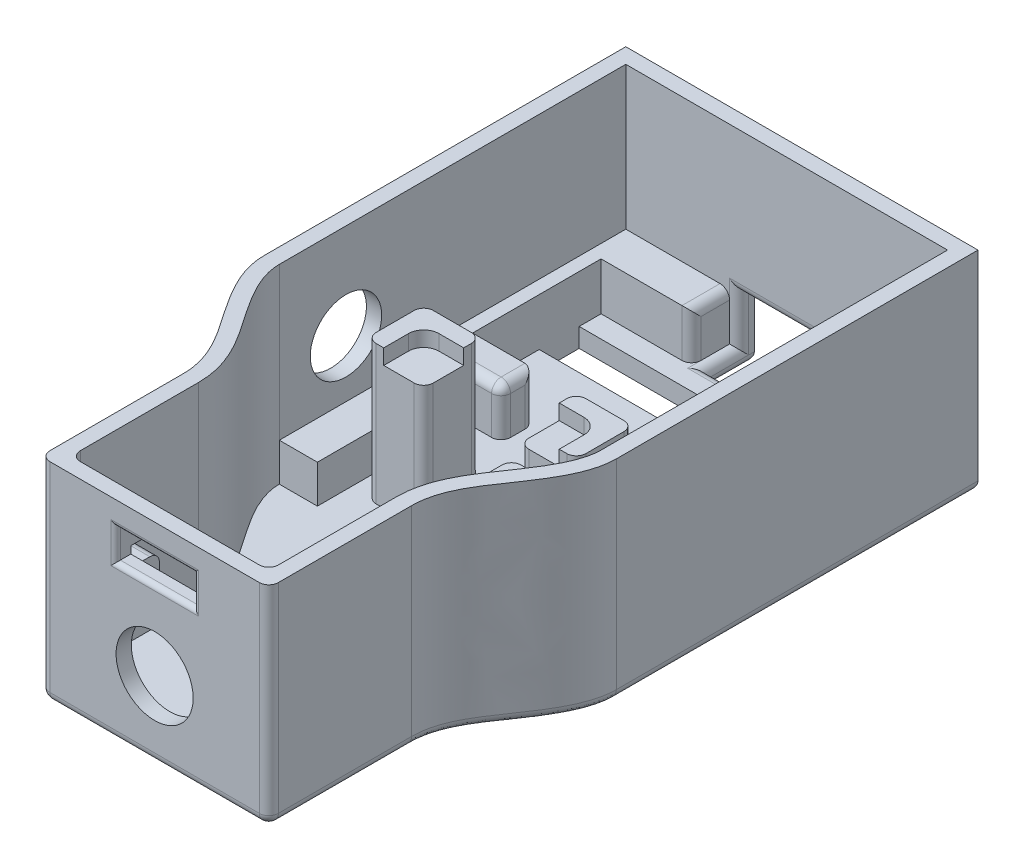
from build123d import *

# Parameters (mm, degrees)
BOSS_EXTRUDE1_DEPTH            = 2
BOSS_EXTRUDE2_DEPTH            = 20
FILLET1_R                      = 1
FILLET1_OF_MIRROR1_R           = 1
CUT_EXTRUDE1_REACH             = 75.255
SKETCH2_R                      = 4.05
SKETCH2_W                      = 8.2
SKETCH2_H                      = 3.2
BOSS_EXTRUDE3_DEPTH            = 5
SKETCH4_W                      = 10
SKETCH4_H                      = 7
CUT_EXTRUDE2_DEPTH             = 5
CUT_EXTRUDE3_REACH             = 81.956
SKETCH5_R                      = 3.75
SKETCH6_W                      = 4
SKETCH6_H                      = 15.4
BOSS_EXTRUDE4_DEPTH            = 4
BOSS_EXTRUDE5_DEPTH            = 3
SKETCH9_W                      = 6
SKETCH9_H                      = 6
BOSS_EXTRUDE7_DEPTH            = 13
BOSS_EXTRUDE8_DEPTH            = 1.6
SKETCH11_W                     = 10
SKETCH11_H                     = 5
BOSS_EXTRUDE9_DEPTH            = 1.95
FILLET2_R                      = 1
CUT_EXTRUDE4_REACH             = 74.746
SKETCH12_R                     = 1.7
CHAMFER1_SIZE                  = 1.8
FILLET3_R                      = 0.5
FILLET4_R                      = 0.5
FILLET5_R                      = 1
CUT_EXTRUDE5_REACH             = 75.255
SKETCH13_W                     = 4.2
SKETCH13_H                     = 2
CUT_EXTRUDE5_DIRECTION_2_REACH = 75.255
FILLET6_R                      = 1


# Some blends are built 0.0001 mm under size
with BuildPart() as part:
    # Sketch1 → Boss-Extrude1 (new body)
    with BuildSketch(Plane(origin=(0, 0, 0), x_dir=(1, 0, 0), z_dir=(0, 1, 0))):
        with BuildLine():
            Line((-18.5, 68), (0, 68))
            Line((0, 68), (0, 0))
            Line((0, 0), (-12, 0))
            Line((-12, 0), (-12, 15))
            add(Edge.make_bspline(
                [(-18.5, 30), (-18.5, 27.39470469), (-15.25, 22.360202971), (-12, 17.884889368), (-12, 15)],
                knots=[0, 0, 0, 0, 0.5, 1, 1, 1, 1], degree=3))
            Line((-18.5, 30), (-18.5, 68))
        make_face()
    boss_extrude1 = extrude(amount=-BOSS_EXTRUDE1_DEPTH)

    # Sketch1<3> → Boss-Extrude2 (add)
    with BuildSketch(Plane(origin=(0, 0, 0), x_dir=(1, 0, 0), z_dir=(0, 1, 0))):
        with BuildLine():
            Line((0, 68), (-18.5, 68))
            Line((-18.5, 68), (-18.5, 30))
            add(Edge.make_bspline(
                [(-18.5, 30), (-18.5, 27.39470469), (-15.25, 22.360202971), (-12, 17.884889368), (-12, 15)],
                knots=[0, 0, 0, 0, 0.5, 1, 1, 1, 1], degree=3))
            Line((-12, 15), (-12, 0))
            Line((-12, 0), (0, 0))
            Line((0, 0), (0, 1.6))
            Line((0, 1.6), (-10.4, 1.6))
            Line((-10.4, 1.6), (-10.4, 15))
            add(Edge.make_bspline(
                [(-10.4, 15), (-10.4, 15.425578207), (-10.461590664, 16.290428205), (-10.798327914, 17.886130877), (-11.539951261, 19.69830956), (-12.699618033, 21.622399051), (-13.939183968, 23.408598367), (-15.118088909, 25.160360175), (-16.101642577, 26.878994856), (-16.641544438, 28.239751095), (-16.862288026, 29.267999136), (-16.9, 29.752858105), (-16.9, 30)],
                knots=[0, 0, 0, 0, 0.0625, 0.125, 0.25, 0.375, 0.5, 0.625, 0.75, 0.875, 0.9375, 1, 1, 1, 1], degree=3))
            Line((-16.9, 30), (-16.9, 66.4))
            Line((-16.9, 66.4), (0, 66.4))
            Line((0, 66.4), (0, 68))
        make_face()
    boss_extrude2 = extrude(amount=BOSS_EXTRUDE2_DEPTH)

    # Fillet1
    fillet1_edges = [part.edges().sort_by_distance(p)[0] for p in [
        (-12, 9, 0),
        (-10.4, 10, -1.6),
    ]]
    fillet(fillet1_edges, radius=FILLET1_R)

    # Mirror1: Boss-Extrude1, Boss-Extrude2 across plane
    add(boss_extrude1.mirror(Plane(origin=(0, 0, 0), x_dir=(0, 0, 1), z_dir=(1, 0, 0))))
    add(boss_extrude2.mirror(Plane(origin=(0, 0, 0), x_dir=(0, 0, 1), z_dir=(1, 0, 0))))

    # Fillet1 of Mirror1
    fillet1_of_mirror1_edges = [part.edges().sort_by_distance(p)[0] for p in [
        (12, 9, 0),
        (10.4, 10, -1.6),
    ]]
    fillet(fillet1_of_mirror1_edges, radius=FILLET1_OF_MIRROR1_R)

    # Sketch2 → Cut-Extrude1 (cut, up to next)
    with BuildSketch(Plane.XY, mode=Mode.PRIVATE) as cut_extrude1_sk1:
        with Locations((0, 6)):
            Circle(SKETCH2_R)
    cut_extrude1_tool1 = extrude(cut_extrude1_sk1.sketch, amount=-CUT_EXTRUDE1_REACH, mode=Mode.PRIVATE) & part.part
    # Sketch2 → Cut-Extrude1 (cut, up to next)
    with BuildSketch(Plane.XY, mode=Mode.PRIVATE) as cut_extrude1_sk2:
        with Locations((0, 15.84)):
            Rectangle(SKETCH2_W, SKETCH2_H)
    cut_extrude1_tool2 = extrude(cut_extrude1_sk2.sketch, amount=-CUT_EXTRUDE1_REACH, mode=Mode.PRIVATE) & part.part
    add(cut_extrude1_tool1.solids().sort_by_distance((0, 6, 0))[0], mode=Mode.SUBTRACT)
    add(cut_extrude1_tool2.solids().sort_by_distance((0, 15.84, 0))[0], mode=Mode.SUBTRACT)

    # Sketch3 → Boss-Extrude3 (add)
    with BuildSketch(Plane(origin=(0, 0, 0), x_dir=(1, 0, 0), z_dir=(0, 1, 0))):
        Polygon((-16.9, 66.4), (-6, 66.4), (-6, 62.4), (-15.5, 62.4), (-15.5, 48.9), (-9, 48.9), (-9, 45.4), (-16.9, 45.4), align=None)
        Polygon((16.9, 66.4), (16.9, 45.4), (9, 45.4), (9, 48.9), (15.5, 48.9), (15.5, 62.4), (6, 62.4), (6, 66.4), align=None)
    extrude(amount=BOSS_EXTRUDE3_DEPTH)

    # Sketch4 → Cut-Extrude2 (cut)
    with BuildSketch(Plane(origin=(0, 0, -68), x_dir=(-1, 0, 0), z_dir=(0, 0, -1))):
        with Locations((0, 1.5)):
            Rectangle(SKETCH4_W, SKETCH4_H)
    extrude(amount=-CUT_EXTRUDE2_DEPTH, mode=Mode.SUBTRACT)

    # Sketch5 → Cut-Extrude3 (cut, up to next)
    with BuildSketch(Plane.ZY.offset(18.5), mode=Mode.PRIVATE) as cut_extrude3_sk1:
        with Locations((-37, 10)):
            Circle(SKETCH5_R)
    cut_extrude3_tool1 = extrude(cut_extrude3_sk1.sketch, amount=-CUT_EXTRUDE3_REACH, mode=Mode.PRIVATE) & part.part
    add(cut_extrude3_tool1.solids().sort_by_distance((-18.5, 10, -37))[0], mode=Mode.SUBTRACT)

    # Sketch6 → Boss-Extrude4 (add)
    with BuildSketch(Plane(origin=(0, 0, 0), x_dir=(1, 0, 0), z_dir=(0, 1, 0))):
        with Locations((-14.9, 37.7)):
            Rectangle(SKETCH6_W, SKETCH6_H)
    extrude(amount=BOSS_EXTRUDE4_DEPTH)

    # Sketch7 → Boss-Extrude5 (add)
    with BuildSketch(Plane(origin=(0, 0, -1.6), x_dir=(-1, 0, 0), z_dir=(0, 0, -1))):
        Polygon((4.1, 13), (9, 13), (9, 15), (4.1, 15), (4.1, 17), (11.1, 17), (11.1, 11), (4.1, 11), align=None)
    boss_extrude5 = extrude(amount=BOSS_EXTRUDE5_DEPTH)

    # Sketch9 → Boss-Extrude7 (add)
    with BuildSketch(Plane(origin=(0, 0, 0), x_dir=(1, 0, 0), z_dir=(0, 1, 0))):
        with Locations((-8.018025612, 36.288025612)):
            Rectangle(SKETCH9_W, SKETCH9_H)
    boss_extrude7 = extrude(amount=BOSS_EXTRUDE7_DEPTH)

    # Sketch10 → Boss-Extrude8 (add)
    with BuildSketch(Plane(origin=(0, 13, 0), x_dir=(1, 0, 0), z_dir=(0, 1, 0))):
        with BuildLine():
            Line((-11.018025612, 39.288025612), (-11.018025612, 33.288025612))
            Line((-11.018025612, 33.288025612), (-9.218025612, 33.288025612))
            Line((-9.218025612, 33.288025612), (-9.218025612, 35.888025612))
            ThreePointArc((-9.218025612, 35.888025612), (-8.749396462, 37.019396462), (-7.618025612, 37.488025612))
            Line((-7.618025612, 37.488025612), (-5.018025612, 37.488025612))
            Line((-5.018025612, 37.488025612), (-5.018025612, 39.288025612))
            Line((-5.018025612, 39.288025612), (-11.018025612, 39.288025612))
        make_face()
    boss_extrude8 = extrude(amount=BOSS_EXTRUDE8_DEPTH)

    # Mirror2: Boss-Extrude5, Boss-Extrude7, Boss-Extrude8 across plane
    add(boss_extrude5.mirror(Plane(origin=(0, 0, 0), x_dir=(0, 0, 1), z_dir=(1, 0, 0))))
    add(boss_extrude7.mirror(Plane(origin=(0, 0, 0), x_dir=(0, 0, 1), z_dir=(1, 0, 0))))
    add(boss_extrude8.mirror(Plane(origin=(0, 0, 0), x_dir=(0, 0, 1), z_dir=(1, 0, 0))))

    # Sketch11 → Boss-Extrude9 (add)
    with BuildSketch(Plane(origin=(0, 0, 0), x_dir=(1, 0, 0), z_dir=(0, 1, 0))):
        with Locations((0, 39.988025612)):
            Rectangle(SKETCH11_W, SKETCH11_H)
    extrude(amount=BOSS_EXTRUDE9_DEPTH)

    # Fillet2
    fillet2_edges = [part.edges().sort_by_distance(p)[0] for p in [
        (-6, 2.5, -62.4),
        (-9, 2.5, -48.9),
        (-11.018025612, 7.3, -33.288025612),
        (-11.018025612, 7.3, -39.288025612),
        (-5, 0.975, -42.488025612),
        (-9, 2.5, -45.4),
        (0, 5, -66.4),
        (5, 2.5, -66.4),
        (-5, 2.5, -66.4),
        (-5, 0, -64.7),
        (5, 0, -64.7),
        (0, 0, -63),
        (6, 2.5, -62.4),
        (9, 2.5, -45.4),
        (9, 2.5, -48.9),
        (11.018025612, 7.3, -33.288025612),
        (11.018025612, 7.3, -39.288025612),
        (5, 0.975, -42.488025612),
        (5.018025612, 6.5, -33.288025612),
        (-5.018025612, 6.5, -33.288025612),
        (5.018025612, 7.3, -39.288025612),
        (-5.018025612, 7.3, -39.288025612),
        (6, 5, -64.4),
        (-6, 5, -64.4),
        (-9, 5, -47.15),
        (9, 5, -47.15),
        (-12.95, 5, -45.4),
        (12.95, 5, -45.4),
    ]]
    fillet(fillet2_edges, radius=FILLET2_R - 0.0001)  # a hair under: the kernel refuses the full size

    # Sketch12 → Cut-Extrude4 (cut, up to next)
    with BuildSketch(Plane(origin=(0, 1.95, 0), x_dir=(1, 0, 0), z_dir=(0, 1, 0)), mode=Mode.PRIVATE) as cut_extrude4_sk1:
        with Locations(Location((0, 39.988025612, 0), (0, 0, 270))):
            Circle(SKETCH12_R)
    cut_extrude4_tool1 = extrude(cut_extrude4_sk1.sketch, amount=-CUT_EXTRUDE4_REACH, mode=Mode.PRIVATE) & part.part
    add(cut_extrude4_tool1.solids().sort_by_distance((0, 1.95, -39.988026))[0], mode=Mode.SUBTRACT)

    # Chamfer1
    chamfer1_edges = [part.edges().sort_by_distance(p)[0] for p in [
        (0, -2, -41.688025612),
    ]]
    chamfer(chamfer1_edges, length=CHAMFER1_SIZE)

    # Fillet3
    fillet3_edges = [part.edges().sort_by_distance(p)[0] for p in [
        (0, -0.2, -41.688025612),
    ]]
    fillet(fillet3_edges, radius=FILLET3_R)

    # Chamfer2
    # the kernel refuses this chamfer: 1.95 mm, written as the material it adds along each edge
    with BuildSketch(Plane(origin=(-5, 0, -37.488025612), x_dir=(0, 0.9996219169112968, -0.027495876610587132), z_dir=(1, 0, 0))) as chamfer2_piece_1_section:
        with BuildLine():
            Line((2.005912731, 0), (-0.110266952, 2.002879697))
            Line((-0.110266952, 2.002879697), (-0.149252207, 2.001807358))
            ThreePointArc((-0.149252207, 2.001807358), (-0.066551993, 1.001125768), (-0.038985255, -0.001072339))
            Line((-0.038985255, -0.001072339), (0.001072339, -0.038985255))
            ThreePointArc((0.001072339, -0.038985255), (1.003270446, -0.011418517), (2.00698507, -0.038985255))
            Line((2.00698507, -0.038985255), (2.005912731, 0))
        make_face()
    chamfer2_piece_1 = extrude(amount=10, mode=Mode.PRIVATE)
    chamfer2_piece_1 = split(chamfer2_piece_1, bisect_by=Plane(origin=(0, 1.95, -36.843737511), z_dir=(0, -1, 0)), keep=Keep.TOP, mode=Mode.PRIVATE)
    add(chamfer2_piece_1)
    with BuildSketch(Plane(origin=(-5, 0, -41.488125612), x_dir=(0.027495876610586247, 0.9996219169112968, 0), z_dir=(0, 0, 1))) as chamfer2_piece_2_section:
        with BuildLine():
            Line((2.005912731, 0), (-0.110266952, 2.002879697))
            Line((-0.110266952, 2.002879697), (-0.149252207, 2.001807358))
            ThreePointArc((-0.149252207, 2.001807358), (-0.066551993, 1.001125768), (-0.038985255, -0.001072339))
            Line((-0.038985255, -0.001072339), (0.001072339, -0.038985255))
            ThreePointArc((0.001072339, -0.038985255), (1.003270446, -0.011418517), (2.00698507, -0.038985255))
            Line((2.00698507, -0.038985255), (2.005912731, 0))
        make_face()
    chamfer2_piece_2 = extrude(amount=4.0001, mode=Mode.PRIVATE)
    chamfer2_piece_2 = split(chamfer2_piece_2, bisect_by=Plane(origin=(-5.644288101, 1.95, -39.488075612), z_dir=(0, -1, 0)), keep=Keep.TOP, mode=Mode.PRIVATE)
    add(chamfer2_piece_2)
    with BuildSketch(Plane(origin=(-4.0001, 0, -41.488125612), x_dir=(0, 0, -1), z_dir=(1, 0, 0))) as chamfer2_piece_3_section:
        with BuildLine():
            Line((0.944745671, 2.005154329), (3.005054329, -0.055154329))
            Line((3.005054329, -0.055154329), (3.005054329, -0.094154329))
            ThreePointArc((3.005054329, -0.094154329), (2.002477164, -0.039), (0.9999, -0.039))
            Line((0.9999, -0.039), (0.9609, 0))
            ThreePointArc((0.9609, 0), (0.9609, 1.002577164), (0.905745671, 2.005154329))
            Line((0.905745671, 2.005154329), (0.944745671, 2.005154329))
        make_face()
    chamfer2_piece_3 = revolve(axis=Axis((-4.0001, 0, -41.488125612), (0, 1, 0)), revolution_arc=90, mode=Mode.PRIVATE)
    chamfer2_piece_3 = split(chamfer2_piece_3, bisect_by=Plane(origin=(-5.140152653, 1.95, -42.628178265), z_dir=(0, -1, 0)), keep=Keep.TOP, mode=Mode.PRIVATE)
    add(chamfer2_piece_3)
    with BuildSketch(Plane(origin=(5, 0, -37.488025612), x_dir=(-0.027495876610586247, 0.9996219169112968, 0), z_dir=(0, 0, -1))) as chamfer2_piece_4_section:
        with BuildLine():
            Line((2.005912731, 0), (-0.110266952, 2.002879697))
            Line((-0.110266952, 2.002879697), (-0.149252207, 2.001807358))
            ThreePointArc((-0.149252207, 2.001807358), (-0.066551993, 1.001125768), (-0.038985255, -0.001072339))
            Line((-0.038985255, -0.001072339), (0.001072339, -0.038985255))
            ThreePointArc((0.001072339, -0.038985255), (1.003270446, -0.011418517), (2.00698507, -0.038985255))
            Line((2.00698507, -0.038985255), (2.005912731, 0))
        make_face()
    chamfer2_piece_4 = extrude(amount=4.0001, mode=Mode.PRIVATE)
    chamfer2_piece_4 = split(chamfer2_piece_4, bisect_by=Plane(origin=(5.644288101, 1.95, -39.488075612), z_dir=(0, -1, 0)), keep=Keep.TOP, mode=Mode.PRIVATE)
    add(chamfer2_piece_4)
    with BuildSketch(Plane(origin=(4.0001, 0, -41.488125612), x_dir=(0, 0, -1), z_dir=(-1, 0, 0))) as chamfer2_piece_5_section:
        with BuildLine():
            Line((0.944745671, -2.005154329), (3.005054329, 0.055154329))
            Line((3.005054329, 0.055154329), (3.005054329, 0.094154329))
            ThreePointArc((3.005054329, 0.094154329), (2.002477164, 0.039), (0.9999, 0.039))
            Line((0.9999, 0.039), (0.9609, 0))
            ThreePointArc((0.9609, 0), (0.9609, -1.002577164), (0.905745671, -2.005154329))
            Line((0.905745671, -2.005154329), (0.944745671, -2.005154329))
        make_face()
    chamfer2_piece_5 = revolve(axis=Axis((4.0001, 0, -41.488125612), (0, -1, 0)), revolution_arc=90, mode=Mode.PRIVATE)
    chamfer2_piece_5 = split(chamfer2_piece_5, bisect_by=Plane(origin=(5.140152653, 1.95, -42.628178265), z_dir=(0, -1, 0)), keep=Keep.TOP, mode=Mode.PRIVATE)
    add(chamfer2_piece_5)
    with BuildSketch(Plane(origin=(4.0001, 0, -42.488025612), x_dir=(0, 0.9996219169112968, 0.027495876610587132), z_dir=(-1, 0, 0))) as chamfer2_piece_6_section:
        with BuildLine():
            Line((2.005912731, 0), (-0.110266952, 2.002879697))
            Line((-0.110266952, 2.002879697), (-0.149252207, 2.001807358))
            ThreePointArc((-0.149252207, 2.001807358), (-0.066551993, 1.001125768), (-0.038985255, -0.001072339))
            Line((-0.038985255, -0.001072339), (0.001072339, -0.038985255))
            ThreePointArc((0.001072339, -0.038985255), (1.003270446, -0.011418517), (2.00698507, -0.038985255))
            Line((2.00698507, -0.038985255), (2.005912731, 0))
        make_face()
    chamfer2_piece_6 = extrude(amount=8.0002, mode=Mode.PRIVATE)
    chamfer2_piece_6 = split(chamfer2_piece_6, bisect_by=Plane(origin=(0, 1.95, -43.132313713), z_dir=(0, -1, 0)), keep=Keep.TOP, mode=Mode.PRIVATE)
    add(chamfer2_piece_6)
    with BuildSketch(Plane(origin=(-5, 0, -41.488125612), x_dir=(0.027495876610586247, 0.9996219169112968, 0), z_dir=(0, 0, 1))) as chamfer2_piece_7a_section:
        with BuildLine():
            Line((2.005912731, 0), (-0.110266952, 2.002879697))
            Line((-0.110266952, 2.002879697), (-0.149252207, 2.001807358))
            ThreePointArc((-0.149252207, 2.001807358), (-0.066551993, 1.001125768), (-0.038985255, -0.001072339))
            Line((-0.038985255, -0.001072339), (0.001072339, -0.038985255))
            ThreePointArc((0.001072339, -0.038985255), (1.003270446, -0.011418517), (2.00698507, -0.038985255))
            Line((2.00698507, -0.038985255), (2.005912731, 0))
        make_face()
    chamfer2_piece_7a = extrude(amount=9.014881827, mode=Mode.PRIVATE)
    chamfer2_piece_7a = split(chamfer2_piece_7a, bisect_by=Plane(origin=(-5.644288101, 1.95, -34.980634699), z_dir=(0, -1, 0)), keep=Keep.TOP, mode=Mode.PRIVATE)
    chamfer2_piece_7a = split(chamfer2_piece_7a, bisect_by=Plane(origin=(-5.644288101, 0.640836951, -37.488025612), z_dir=(0, 0, 1)), keep=Keep.TOP, mode=Mode.PRIVATE)
    with BuildSketch(Plane(origin=(-10.014781827, 0, -37.488025612), x_dir=(0, 0.9996219169112968, -0.027495876610587132), z_dir=(1, 0, 0))) as chamfer2_piece_7b_section:
        with BuildLine():
            Line((2.005912731, 0), (-0.110266952, 2.002879697))
            Line((-0.110266952, 2.002879697), (-0.149252207, 2.001807358))
            ThreePointArc((-0.149252207, 2.001807358), (-0.066551993, 1.001125768), (-0.038985255, -0.001072339))
            Line((-0.038985255, -0.001072339), (0.001072339, -0.038985255))
            ThreePointArc((0.001072339, -0.038985255), (1.003270446, -0.011418517), (2.00698507, -0.038985255))
            Line((2.00698507, -0.038985255), (2.005912731, 0))
        make_face()
    chamfer2_piece_7b = extrude(amount=15.014781827, mode=Mode.PRIVATE)
    chamfer2_piece_7b = split(chamfer2_piece_7b, bisect_by=Plane(origin=(-7.507390913, 1.95, -36.843737511), z_dir=(0, -1, 0)), keep=Keep.TOP, mode=Mode.PRIVATE)
    chamfer2_piece_7b = split(chamfer2_piece_7b, bisect_by=Plane(origin=(-5, 0.640836951, -36.843737511), z_dir=(-1, 0, 0)), keep=Keep.TOP, mode=Mode.PRIVATE)
    chamfer2_piece_7 = chamfer2_piece_7a & chamfer2_piece_7b
    add(chamfer2_piece_7)
    with BuildSketch(Plane(origin=(5, 0, -32.473243786), x_dir=(-0.027495876610586247, 0.9996219169112968, 0), z_dir=(0, 0, -1))) as chamfer2_piece_8a_section:
        with BuildLine():
            Line((2.005912731, 0), (-0.110266952, 2.002879697))
            Line((-0.110266952, 2.002879697), (-0.149252207, 2.001807358))
            ThreePointArc((-0.149252207, 2.001807358), (-0.066551993, 1.001125768), (-0.038985255, -0.001072339))
            Line((-0.038985255, -0.001072339), (0.001072339, -0.038985255))
            ThreePointArc((0.001072339, -0.038985255), (1.003270446, -0.011418517), (2.00698507, -0.038985255))
            Line((2.00698507, -0.038985255), (2.005912731, 0))
        make_face()
    chamfer2_piece_8a = extrude(amount=9.014881827, mode=Mode.PRIVATE)
    chamfer2_piece_8a = split(chamfer2_piece_8a, bisect_by=Plane(origin=(5.644288101, 1.95, -34.980634699), z_dir=(0, -1, 0)), keep=Keep.TOP, mode=Mode.PRIVATE)
    chamfer2_piece_8a = split(chamfer2_piece_8a, bisect_by=Plane(origin=(5.644288101, 0.640836951, -37.488025612), z_dir=(0, 0, 1)), keep=Keep.TOP, mode=Mode.PRIVATE)
    with BuildSketch(Plane(origin=(-5, 0, -37.488025612), x_dir=(0, 0.9996219169112968, -0.027495876610587132), z_dir=(1, 0, 0))) as chamfer2_piece_8b_section:
        with BuildLine():
            Line((2.005912731, 0), (-0.110266952, 2.002879697))
            Line((-0.110266952, 2.002879697), (-0.149252207, 2.001807358))
            ThreePointArc((-0.149252207, 2.001807358), (-0.066551993, 1.001125768), (-0.038985255, -0.001072339))
            Line((-0.038985255, -0.001072339), (0.001072339, -0.038985255))
            ThreePointArc((0.001072339, -0.038985255), (1.003270446, -0.011418517), (2.00698507, -0.038985255))
            Line((2.00698507, -0.038985255), (2.005912731, 0))
        make_face()
    chamfer2_piece_8b = extrude(amount=15.014781827, mode=Mode.PRIVATE)
    chamfer2_piece_8b = split(chamfer2_piece_8b, bisect_by=Plane(origin=(7.507390913, 1.95, -36.843737511), z_dir=(0, -1, 0)), keep=Keep.TOP, mode=Mode.PRIVATE)
    chamfer2_piece_8b = split(chamfer2_piece_8b, bisect_by=Plane(origin=(5, 0.640836951, -36.843737511), z_dir=(1, 0, 0)), keep=Keep.TOP, mode=Mode.PRIVATE)
    chamfer2_piece_8 = chamfer2_piece_8a & chamfer2_piece_8b
    add(chamfer2_piece_8)

    # Fillet4
    fillet4_edges = [part.edges().sort_by_distance(p)[0] for p in [
        (-4.1, 15.84, 0),
        (0, 14.24, 0),
        (4.1, 15.84, 0),
        (0, 17.44, 0),
    ]]
    fillet(fillet4_edges, radius=FILLET4_R)

    # Fillet5
    fillet5_edges = [part.edges().sort_by_distance(p)[0] for p in [
        (-6.55, 15, -4.6),
        (-9, 14, -4.6),
        (-6.55, 13, -4.6),
        (6.55, 13, -4.6),
        (9, 14, -4.6),
        (6.55, 15, -4.6),
    ]]
    fillet(fillet5_edges, radius=FILLET5_R)

    # Cut-Extrude5: up to this face of the body (flat: up to its plane)
    cut_extrude5_end = Plane(part.part.faces().sort_by_distance((-15.5, 2.5, -55.65))[0])
    # Sketch13 → Cut-Extrude5 (cut, up to the picked face)
    with BuildSketch(Plane(origin=(0, 0, 0), x_dir=(0, 0, -1), z_dir=(1, 0, 0)), mode=Mode.PRIVATE) as cut_extrude5_sk1:
        with Locations((58, -1)):
            Rectangle(SKETCH13_W, SKETCH13_H)
    cut_extrude5_tool1 = split(extrude(cut_extrude5_sk1.sketch, amount=-CUT_EXTRUDE5_REACH, mode=Mode.PRIVATE), bisect_by=cut_extrude5_end, keep=Keep.BOTH, mode=Mode.PRIVATE)
    add(cut_extrude5_tool1.solids().sort_by(Axis((0, -1, -58), (-1, 0, 0)))[0], mode=Mode.SUBTRACT)

    # Cut-Extrude5 direction 2: up to this face of the body (flat: up to its plane)
    cut_extrude5_direction_2_end = Plane(part.part.faces().sort_by_distance((15.5, 2.5, -55.65))[0])
    # Sketch13 → Cut-Extrude5 direction 2 (cut, up to the picked face)
    with BuildSketch(Plane(origin=(0, 0, 0), x_dir=(0, 0, -1), z_dir=(1, 0, 0)), mode=Mode.PRIVATE) as cut_extrude5_direction_2_sk1:
        with Locations((58, -1)):
            Rectangle(SKETCH13_W, SKETCH13_H)
    cut_extrude5_direction_2_tool1 = split(extrude(cut_extrude5_direction_2_sk1.sketch, amount=CUT_EXTRUDE5_DIRECTION_2_REACH, mode=Mode.PRIVATE), bisect_by=cut_extrude5_direction_2_end, keep=Keep.BOTH, mode=Mode.PRIVATE)
    add(cut_extrude5_direction_2_tool1.solids().sort_by(Axis((0, -1, -58), (1, 0, 0)))[0], mode=Mode.SUBTRACT)

    # Fillet6
    fillet6_edges = [part.edges().sort_by_distance(p)[0] for p in [
        (-18.5, -2, -49),
        (-15.245581068, -2, -22.49353523),
        (-12, -2, -8),
        (-11.707106781, -2, -0.292893219),
        (0, -2, 0),
        (11.707106781, -2, -0.292893219),
        (18.5, -2, -49),
        (15.245581068, -2, -22.49353523),
        (5, -2, -65.5),
        (0, -2, -63),
        (-5, -2, -65.5),
        (-11.75, -2, -68),
        (11.75, -2, -68),
        (12, -2, -8),
    ]]
    fillet(fillet6_edges, radius=FILLET6_R)


solid = part.part
